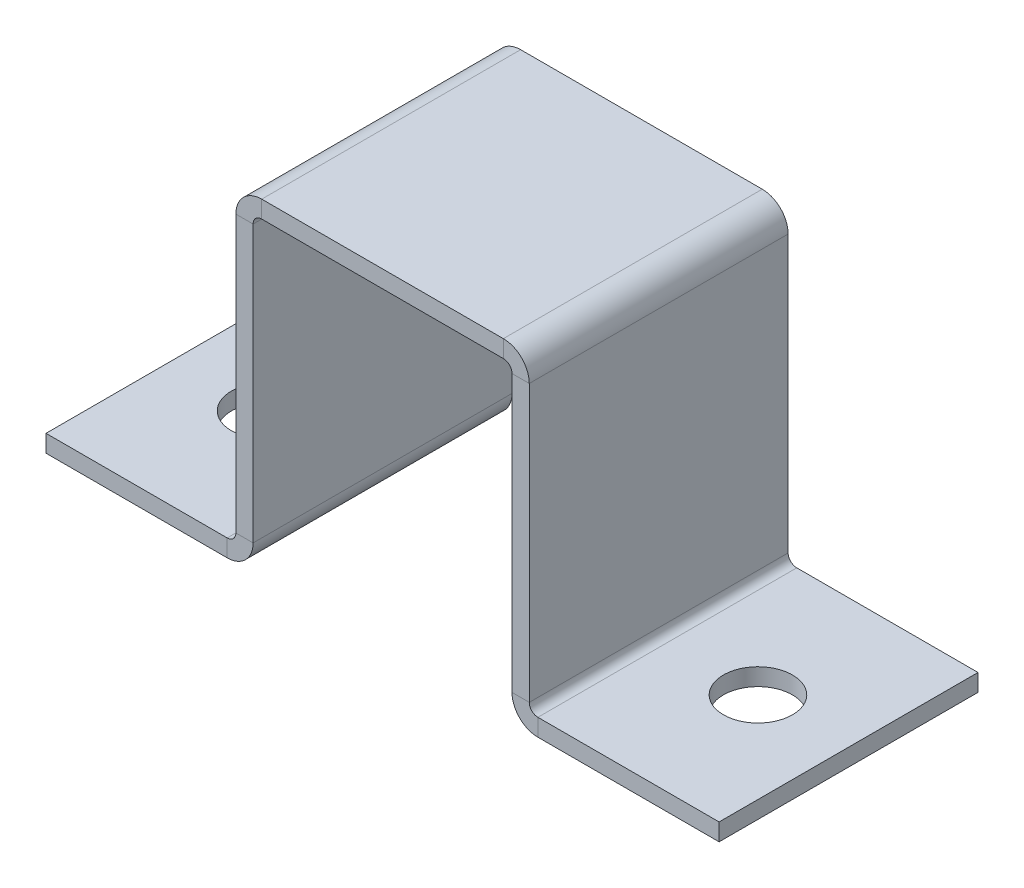
from build123d import *

# Parameters (mm, degrees)
FLANGE_BASE1_DEPTH    = 15
ESBO_O3_R             = 2
CORTE_EXTRUS_O2_DEPTH = 10


# Sheet-metal steps are written as plain solids
with BuildPart() as part:
    # Esboço1 → Flange-base1 (new body)
    with BuildSketch(Plane.XY):
        with BuildLine():
            Line((-19.5, 0), (-9, 0))
            ThreePointArc((-9, 0), (-7.939339828, 0.439339828), (-7.5, 1.5))
            Line((-7.5, 1.5), (-7.5, 17.5))
            ThreePointArc((-7.5, 17.5), (-7.353553391, 17.853553391), (-7, 18))
            Line((-7, 18), (7, 18))
            ThreePointArc((7, 18), (7.353553391, 17.853553391), (7.5, 17.5))
            Line((7.5, 17.5), (7.5, 1.5))
            ThreePointArc((7.5, 1.5), (7.939339828, 0.439339828), (9, 0))
            Line((9, 0), (19.5, 0))
            Line((19.5, 0), (19.5, 1))
            Line((19.5, 1), (9, 1))
            ThreePointArc((9, 1), (8.646446609, 1.146446609), (8.5, 1.5))
            Line((8.5, 1.5), (8.5, 17.5))
            ThreePointArc((8.5, 17.5), (8.060660172, 18.560660172), (7, 19))
            Line((7, 19), (-7, 19))
            ThreePointArc((-7, 19), (-8.060660172, 18.560660172), (-8.5, 17.5))
            Line((-8.5, 17.5), (-8.5, 1.5))
            ThreePointArc((-8.5, 1.5), (-8.646446609, 1.146446609), (-9, 1))
            Line((-9, 1), (-19.5, 1))
            Line((-19.5, 1), (-19.5, 0))
        make_face()
    extrude(amount=FLANGE_BASE1_DEPTH)

    # Esboço3 → Corte-extrusão2 (cut)
    with BuildSketch(Plane(origin=(0, 1, 0), x_dir=(1, 0, 0), z_dir=(0, 1, 0))):
        with Locations(Location((-14.25, -7.5, 0), (0, 0, 270))):
            Circle(ESBO_O3_R)
        with Locations(Location((14.25, -7.5, 0), (0, 0, 270))):
            Circle(ESBO_O3_R)
    extrude(amount=-CORTE_EXTRUS_O2_DEPTH, mode=Mode.SUBTRACT)


solid = part.part
